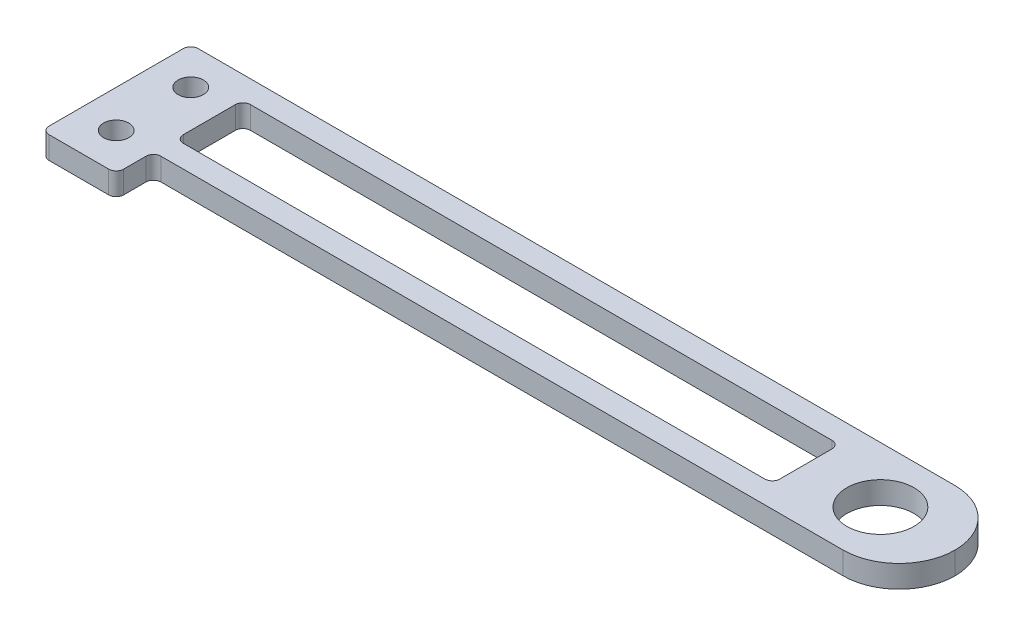
from build123d import *

# Parameters (mm, degrees)
BOSS_EXTRUDE1_DEPTH  = 3
M8_CLEARANCE_HOLE1_D = 9
M3_CLEARANCE_HOLE1_D = 3.4
FILLET1_R            = 1
FILLET2_R            = 7.5
SKETCH6_W            = 80
SKETCH6_H            = 9
CUT_EXTRUDE1_DEPTH   = 112.843640856
FILLET3_R            = 1


with BuildPart() as part:
    # Sketch1 → Boss-Extrude1 (new body)
    with BuildSketch(Plane(origin=(0, 0, 0), x_dir=(1, 0, 0), z_dir=(0, 1, 0))):
        Polygon((0, 0), (0, 20), (110, 20), (110, 5), (10, 5), (10, 0), align=None)
    extrude(amount=BOSS_EXTRUDE1_DEPTH)

    # M8 Clearance Hole1 (through all)
    with Locations(Plane(origin=(100, 3, -12.5), x_dir=(0, 0, 1), z_dir=(0, 1, 0))):
        with Locations((0, 0)):
            Hole(M8_CLEARANCE_HOLE1_D / 2)

    # M3 Clearance Hole1 (through all)
    with Locations(Plane(origin=(5, 3, -15), x_dir=(0, 0, 1), z_dir=(0, 1, 0))):
        with Locations((0, 0), (10, 0)):
            Hole(M3_CLEARANCE_HOLE1_D / 2)

    # Fillet1
    fillet1_edges = [part.edges().sort_by_distance(p)[0] for p in [
        (0, 1.5, 0),
        (0, 1.5, -20),
        (10, 1.5, -5),
        (10, 1.5, 0),
    ]]
    fillet(fillet1_edges, radius=FILLET1_R)

    # Fillet2
    fillet2_edges = [part.edges().sort_by_distance(p)[0] for p in [
        (110, 1.5, -20),
        (110, 1.5, -5),
    ]]
    fillet(fillet2_edges, radius=FILLET2_R - 0.0001)  # a hair under: the kernel refuses the full size

    # Sketch6 → Cut-Extrude1 (cut, through all)
    with BuildSketch(Plane(origin=(0, 3, 0), x_dir=(1, 0, 0), z_dir=(0, 1, 0))):
        with Locations((50, 12.5)):
            Rectangle(SKETCH6_W, SKETCH6_H)
    extrude(amount=-CUT_EXTRUDE1_DEPTH, mode=Mode.SUBTRACT)

    # Fillet3
    fillet3_edges = [part.edges().sort_by_distance(p)[0] for p in [
        (10, 1.5, -8),
        (10, 1.5, -17),
        (90, 1.5, -17),
        (90, 1.5, -8),
    ]]
    fillet(fillet3_edges, radius=FILLET3_R)


solid = part.part
